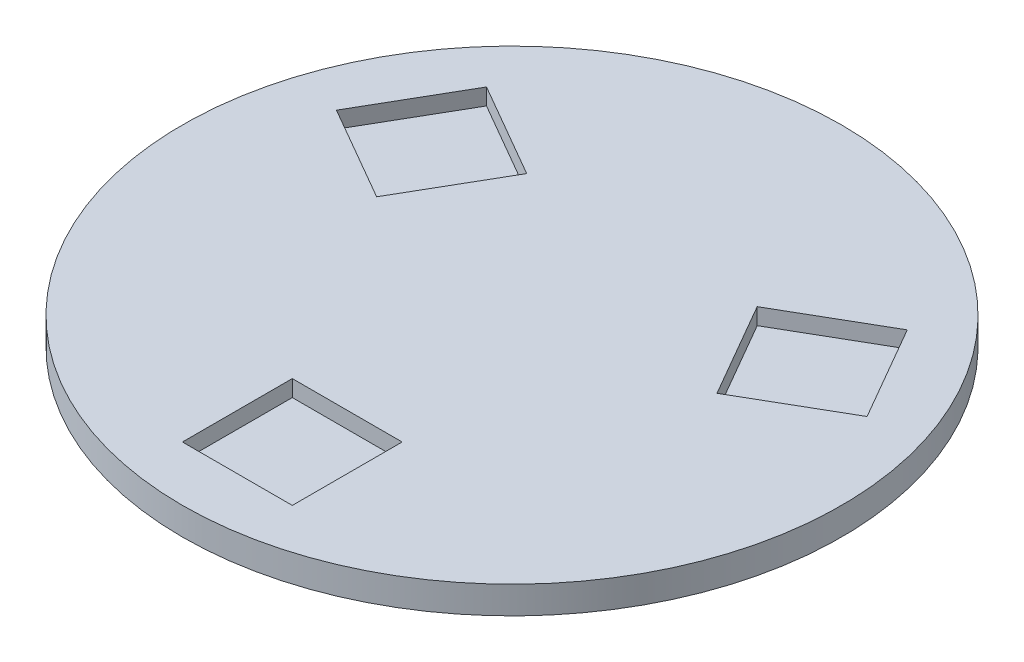
from build123d import *

# Parameters (mm, degrees)
SKETCH1_R           = 3000
BOSS_EXTRUDE1_DEPTH = 250
SKETCH2_W           = 1000
SKETCH2_H           = 1000
CUT_EXTRUDE1_DEPTH  = 150
CIRPATTERN1_COUNT   = 3


with BuildPart() as part:
    # Sketch1 → Boss-Extrude1 (new body)
    with BuildSketch(Plane(origin=(0, 0, 0), x_dir=(1, 0, 0), z_dir=(0, 1, 0))):
        Circle(SKETCH1_R)
    extrude(amount=BOSS_EXTRUDE1_DEPTH)

    # Sketch2 → Cut-Extrude1 (cut)
    with BuildSketch(Plane(origin=(0, 250, 0), x_dir=(1, 0, 0), z_dir=(0, 1, 0))):
        with Locations((0, -2000)):
            Rectangle(SKETCH2_W, SKETCH2_H)
    cut_extrude1 = extrude(amount=-CUT_EXTRUDE1_DEPTH, mode=Mode.SUBTRACT)

    # CirPattern1: Cut-Extrude1 ×3 about axis
    cirpattern1_axis = Axis((0, 250, 0), (0, 1, 0))
    for i in range(1, CIRPATTERN1_COUNT):
        add(cut_extrude1.rotate(cirpattern1_axis, i * 360 / CIRPATTERN1_COUNT), mode=Mode.SUBTRACT)


solid = part.part
